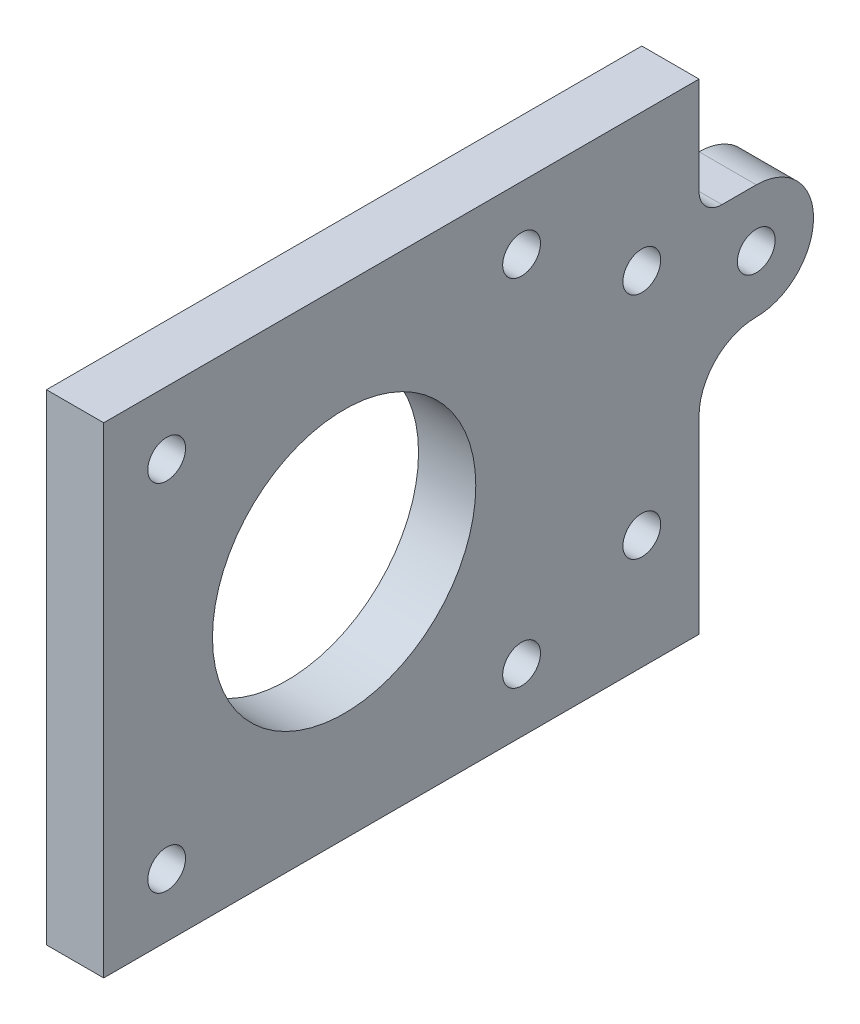
from build123d import *

# Parameters (mm, degrees)
SKETCH1_W           = 42
SKETCH1_H           = 42
BOSS_EXTRUDE1_DEPTH = 5
SKETCH2_R           = 1.65
CUT_EXTRUDE1_DEPTH  = 5
SKETCH3_W           = 5
SKETCH3_H           = 42
BOSS_EXTRUDE2_DEPTH = 10
SKETCH4_W           = 5
SKETCH4_H           = 10
BOSS_EXTRUDE3_DEPTH = 10
SKETCH5_R           = 1.65
CUT_EXTRUDE2_DEPTH  = 10
FILLET1_R           = 5
FILLET2_R           = 2
SKETCH6_R           = 11.5
CUT_EXTRUDE3_DEPTH  = 10


with BuildPart() as part:
    # Sketch1 → Boss-Extrude1 (new body)
    with BuildSketch(Plane(origin=(0, 0, 0), x_dir=(0, 0, -1), z_dir=(1, 0, 0))):
        with Locations((21, -21)):
            Rectangle(SKETCH1_W, SKETCH1_H)
    extrude(amount=BOSS_EXTRUDE1_DEPTH)

    # Sketch2 → Cut-Extrude1 (cut)
    with BuildSketch(Plane(origin=(5, 0, 0), x_dir=(0, 0, -1), z_dir=(1, 0, 0))):
        with Locations((5.5, -5.5)):
            Circle(SKETCH2_R)
        with Locations((36.5, -5.5)):
            Circle(SKETCH2_R)
        with Locations((36.5, -36.5)):
            Circle(SKETCH2_R)
        with Locations((5.5, -36.5)):
            Circle(SKETCH2_R)
    extrude(amount=-CUT_EXTRUDE1_DEPTH, mode=Mode.SUBTRACT)

    # Sketch3 → Boss-Extrude2 (add)
    with BuildSketch(Plane(origin=(0, 0, -42), x_dir=(-1, 0, 0), z_dir=(0, 0, -1))):
        with Locations((-2.5, -21)):
            Rectangle(SKETCH3_W, SKETCH3_H)
    extrude(amount=BOSS_EXTRUDE2_DEPTH)

    # Sketch4 → Boss-Extrude3 (add)
    with BuildSketch(Plane(origin=(0, 0, -52), x_dir=(-1, 0, 0), z_dir=(0, 0, -1))):
        with Locations((-2.5, -15.5)):
            Rectangle(SKETCH4_W, SKETCH4_H)
    extrude(amount=BOSS_EXTRUDE3_DEPTH)

    # Sketch5 → Cut-Extrude2 (cut)
    with BuildSketch(Plane(origin=(5, 0, 0), x_dir=(0, 0, -1), z_dir=(1, 0, 0))):
        with Locations((57, -15.5)):
            Circle(SKETCH5_R)
        with Locations((47, -32)):
            Circle(SKETCH5_R)
        with Locations((47, -12)):
            Circle(SKETCH5_R)
    extrude(amount=-CUT_EXTRUDE2_DEPTH, mode=Mode.SUBTRACT)

    # Fillet1
    fillet1_edges = [part.edges().sort_by_distance(p)[0] for p in [
        (2.5, -10.5, -62),
        (2.5, -20.5, -62),
        (2.5, -20.5, -52),
    ]]
    fillet(fillet1_edges, radius=FILLET1_R - 0.0001)  # a hair under: the kernel refuses the full size

    # Fillet2
    fillet2_edges = [part.edges().sort_by_distance(p)[0] for p in [
        (2.5, -10.5, -52),
    ]]
    fillet(fillet2_edges, radius=FILLET2_R)

    # Sketch6 → Cut-Extrude3 (cut)
    with BuildSketch(Plane(origin=(5, 0, 0), x_dir=(0, 0, -1), z_dir=(1, 0, 0))):
        with Locations((21, -21)):
            Circle(SKETCH6_R)
    extrude(amount=-CUT_EXTRUDE3_DEPTH, mode=Mode.SUBTRACT)


solid = part.part
